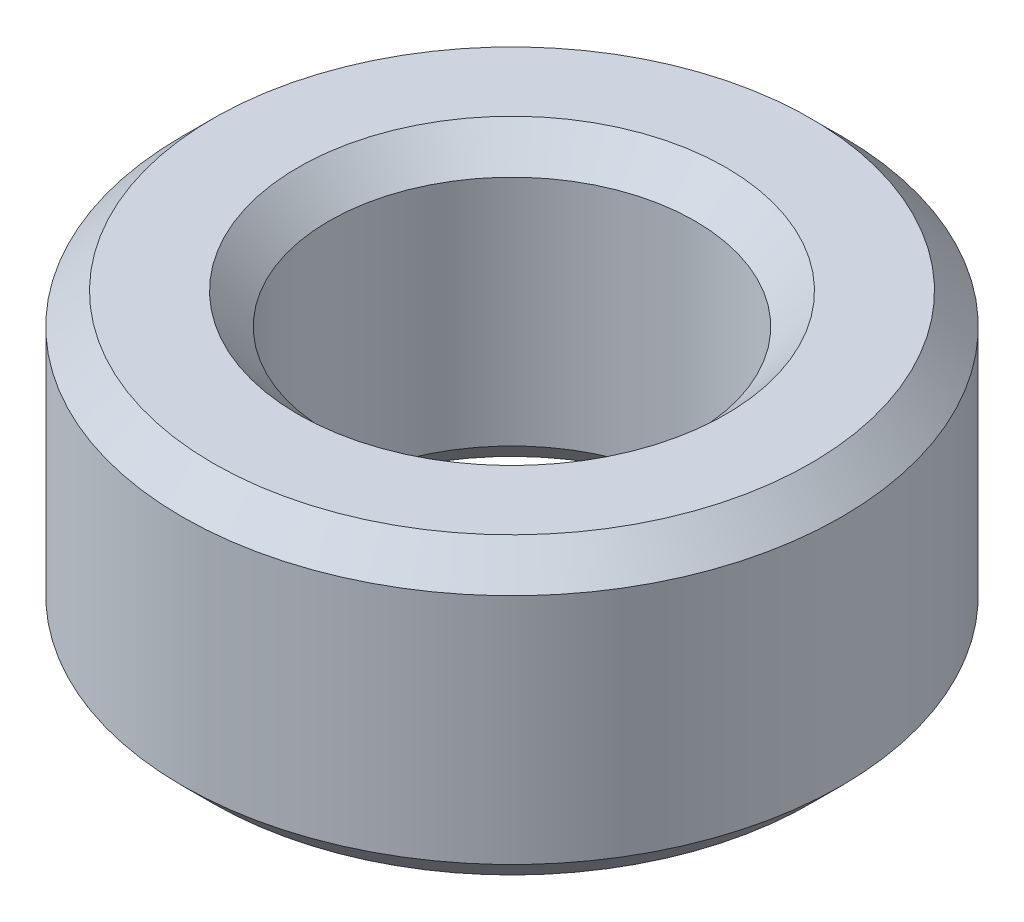
from build123d import *

# Parameters (mm, degrees)
SKETCH1_R           = 27.5
BOSS_EXTRUDE1_DEPTH = 24.57358185
SKETCH2_R           = 15.262159959
CUT_EXTRUDE1_DEPTH  = 47.00392293
CHAMFER1_SIZE       = 2.579247007


with BuildPart() as part:
    # Sketch1 → Boss-Extrude1 (new body)
    with BuildSketch(Plane(origin=(0, 0, 0), x_dir=(1, 0, 0), z_dir=(0, 1, 0))):
        Circle(SKETCH1_R)
    extrude(amount=BOSS_EXTRUDE1_DEPTH)

    # Sketch2 → Cut-Extrude1 (cut, through all)
    with BuildSketch(Plane(origin=(0, 0, 0), x_dir=(1, 0, 0), z_dir=(0, 1, 0))):
        Circle(SKETCH2_R)
    extrude(amount=CUT_EXTRUDE1_DEPTH, mode=Mode.SUBTRACT)

    # Chamfer1
    chamfer1_edges = [part.edges().sort_by_distance(p)[0] for p in [
        (-15.262159959, 24.57358185, 0),
        (-15.262159959, 0, 0),
        (-27.5, 0, 0),
        (-27.5, 24.57358185, 0),
    ]]
    chamfer(chamfer1_edges, length=CHAMFER1_SIZE)


solid = part.part
